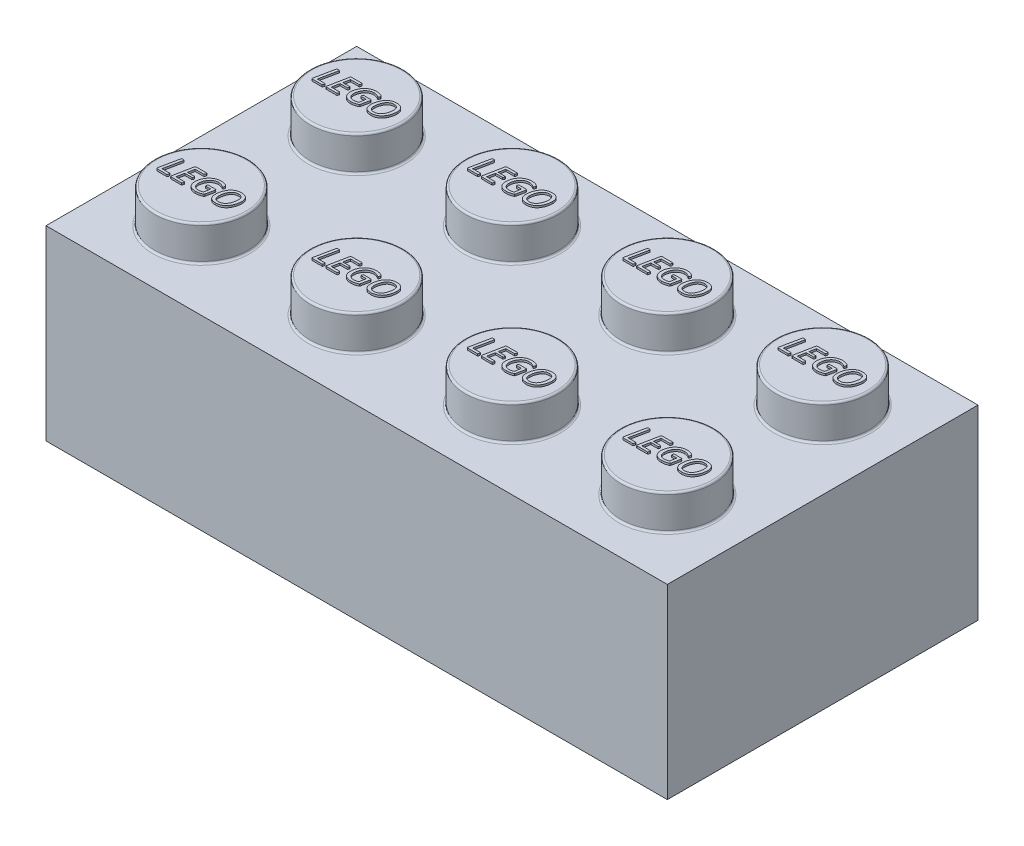
from build123d import *

# Parameters (mm, degrees)
SKETCH2_W              = 32
SKETCH2_H              = 16
BOSS_EXTRUDE1_DEPTH    = 9.6
SKETCH3_R              = 2.4
BOSS_EXTRUDE2_DEPTH    = 1.8
FILLET1_R              = 0.1
BOSS_EXTRUDE3_DEPTH    = 0.1
LPATTERN1_COUNT        = 4
LPATTERN1_PITCH        = 8
LPATTERN1_COUNT_DIR2   = 2
LPATTERN1_PITCH_DIR2   = 8
FILLET1_OF_LPATTERN1_R = 0.1


with BuildPart() as part:
    # Sketch2 → Boss-Extrude1 (new body)
    with BuildSketch(Plane(origin=(0, 0, 0), x_dir=(1, 0, 0), z_dir=(0, 1, 0))):
        Rectangle(SKETCH2_W, SKETCH2_H)
    extrude(amount=BOSS_EXTRUDE1_DEPTH)

    # Sketch3 → Boss-Extrude2 (add)
    with BuildSketch(Plane(origin=(0, 9.6, 0), x_dir=(1, 0, 0), z_dir=(0, 1, 0))):
        with Locations((-12, 4)):
            Circle(SKETCH3_R)
    boss_extrude2 = extrude(amount=BOSS_EXTRUDE2_DEPTH)

    # Fillet1
    fillet1_edges = [part.edges().sort_by_distance(p)[0] for p in [
        (-14.4, 11.4, -4),
        (-14.4, 9.6, -4),
    ]]
    fillet(fillet1_edges, radius=FILLET1_R)

    # Sketch4 → Boss-Extrude3 (add)
    # profile 1 of 4: a face of its own
    with BuildSketch(Plane(origin=(0, 11.4, 0), x_dir=(1, 0, 0), z_dir=(0, 1, 0))):
        with BuildLine():
            add(Edge.make_bspline(
                [(-13.239955728, 3.598746474), (-13.240011408, 3.596910982), (-13.240151135, 3.592304959), (-13.241297767, 3.584400609), (-13.242659472, 3.574712723), (-13.244716594, 3.564149378), (-13.246915271, 3.553119703), (-13.249510268, 3.542125181), (-13.252980365, 3.531408769), (-13.257613483, 3.521675555), (-13.26312257, 3.5129804), (-13.269421836, 3.505982115), (-13.276864093, 3.50088262), (-13.282468208, 3.500289539), (-13.285204112, 3.5)],
                knots=[0, 0, 0, 0, 0.568771865, 1.427287829, 2.47190915, 3.601509247, 4.761408276, 5.957823952, 7.101216275, 8.244900242, 9.290797826, 10.277630826, 11.159146825, 12, 12, 12, 12], degree=3))
            Line((-13.285204112, 3.5), (-13.775186617, 3.5))
            add(Edge.make_bspline(
                [(-13.775186617, 3.5), (-13.778357719, 3.500174379), (-13.784596761, 3.500517464), (-13.793734126, 3.502321168), (-13.80195586, 3.506508546), (-13.809190861, 3.512608473), (-13.814711711, 3.521089488), (-13.81832944, 3.5316915), (-13.818984108, 3.544636463), (-13.817009853, 3.553612034), (-13.815935162, 3.558497911)],
                knots=[0, 0, 0, 0, 0.895402587, 1.761676012, 2.602084678, 3.468358103, 4.400001905, 5.417696982, 6.594316012, 8, 8, 8, 8], degree=3))
            Line((-13.815935162, 3.558497911), (-13.607942589, 4.561962083))
            add(Edge.make_bspline(
                [(-13.607942589, 4.561962083), (-13.607462514, 4.563839367), (-13.606457615, 4.56776893), (-13.602674935, 4.573135592), (-13.59728199, 4.577892347), (-13.589623449, 4.581087248), (-13.580318415, 4.583797402), (-13.568672221, 4.585935711), (-13.554670361, 4.587847386), (-13.544453629, 4.587921302), (-13.538945052, 4.587961155)],
                knots=[0, 0, 0, 0, 0.584098656, 1.222644846, 1.958091128, 2.739123531, 3.71572132, 4.901592816, 6.329425505, 8, 8, 8, 8], degree=3))
            add(Edge.make_bspline(
                [(-13.538945052, 4.587961155), (-13.531936854, 4.587929435), (-13.519144014, 4.587871533), (-13.501817891, 4.585953529), (-13.487968053, 4.583905606), (-13.477612917, 4.581177958), (-13.469738137, 4.578197582), (-13.465282678, 4.573165167), (-13.463139133, 4.567469778), (-13.464011076, 4.563799848), (-13.464447712, 4.561962083)],
                knots=[0, 0, 0, 0, 1.908196571, 3.483242777, 4.748915692, 5.712962573, 6.41404198, 6.993040481, 7.495751958, 8, 8, 8, 8], degree=3))
            Line((-13.464447712, 4.561962083), (-13.656940839, 3.62799543))
            Line((-13.656940839, 3.62799543), (-13.260454996, 3.62799543))
            add(Edge.make_bspline(
                [(-13.260454996, 3.62799543), (-13.257139621, 3.627704925), (-13.250924, 3.627160291), (-13.243752866, 3.620198383), (-13.240579238, 3.610251547), (-13.240178157, 3.60285077), (-13.239955728, 3.598746474)],
                knots=[0, 0, 0, 0, 0.961104778, 1.801866576, 2.780966996, 4, 4, 4, 4], degree=3))
        make_face()
    # profile 2 of 4: a face of its own
    with BuildSketch(Plane(origin=(0, 11.4, 0), x_dir=(1, 0, 0), z_dir=(0, 1, 0))):
        with BuildLine():
            add(Edge.make_bspline(
                [(-12.295989432, 4.558462208), (-12.295963789, 4.556544763), (-12.295901287, 4.551871155), (-12.296564071, 4.544045073), (-12.297075253, 4.534572352), (-12.298927657, 4.524229535), (-12.301562376, 4.513294583), (-12.304074144, 4.502024868), (-12.307403207, 4.491000089), (-12.312179877, 4.481163058), (-12.317573408, 4.472385177), (-12.324240553, 4.465638331), (-12.33197867, 4.460883051), (-12.337677728, 4.460268667), (-12.340487843, 4.459965725)],
                knots=[0, 0, 0, 0, 0.591846085, 1.442574667, 2.423449858, 3.519120045, 4.680220593, 5.897286046, 7.085444994, 8.22495919, 9.267043524, 10.249604938, 11.136907775, 12, 12, 12, 12], degree=3))
            Line((-12.340487843, 4.459965725), (-12.773722374, 4.459965725))
            Line((-12.773722374, 4.459965725), (-12.839970009, 4.123977721))
            Line((-12.839970009, 4.123977721), (-12.475983005, 4.123977721))
            add(Edge.make_bspline(
                [(-12.475983005, 4.123977721), (-12.472957017, 4.123800329), (-12.467202858, 4.123463004), (-12.460245459, 4.11761815), (-12.456425708, 4.108782111), (-12.456142676, 4.102024093), (-12.455983719, 4.09822864)],
                knots=[0, 0, 0, 0, 0.958810056, 1.823254266, 2.777491275, 4, 4, 4, 4], degree=3))
            add(Edge.make_bspline(
                [(-12.455983719, 4.09822864), (-12.456037136, 4.096559247), (-12.456171285, 4.092366755), (-12.457377453, 4.085235116), (-12.458399675, 4.076439805), (-12.460298699, 4.066895451), (-12.461983891, 4.056916791), (-12.465127726, 4.047387541), (-12.468459741, 4.038198948), (-12.47298859, 4.030152346), (-12.477944044, 4.022768802), (-12.484209384, 4.017170164), (-12.491288924, 4.012573179), (-12.496747166, 4.012179156), (-12.499482166, 4.01198172)],
                knots=[0, 0, 0, 0, 0.57613514, 1.446898036, 2.492589559, 3.632582086, 4.806205701, 5.980181914, 7.091495414, 8.172987284, 9.162970952, 10.140332126, 11.068163061, 12, 12, 12, 12], degree=3))
            Line((-12.499482166, 4.01198172), (-12.862219215, 4.01198172))
            Line((-12.862219215, 4.01198172), (-12.938466492, 3.62799543))
            Line((-12.938466492, 3.62799543), (-12.507231889, 3.62799543))
            add(Edge.make_bspline(
                [(-12.507231889, 3.62799543), (-12.504625311, 3.627661682), (-12.499200978, 3.626967146), (-12.492654447, 3.620585431), (-12.488175198, 3.610830914), (-12.488052676, 3.602985239), (-12.487982577, 3.598496483)],
                knots=[0, 0, 0, 0, 0.784088755, 1.631702308, 2.64502263, 4, 4, 4, 4], degree=3))
            add(Edge.make_bspline(
                [(-12.487982577, 3.598496483), (-12.488042517, 3.596328385), (-12.488183381, 3.591233155), (-12.489059185, 3.582829673), (-12.489841869, 3.573030495), (-12.491698357, 3.562623665), (-12.493986245, 3.55179627), (-12.496556194, 3.540796628), (-12.500021023, 3.530042212), (-12.504304463, 3.520179303), (-12.509841791, 3.511654712), (-12.516457613, 3.505229534), (-12.523994076, 3.500648704), (-12.529505906, 3.500214616), (-12.532230997, 3.5)],
                knots=[0, 0, 0, 0, 0.670135299, 1.574879358, 2.610233293, 3.706880817, 4.838360642, 6.031477602, 7.196179589, 8.325899269, 9.347385511, 10.31278335, 11.165827431, 12, 12, 12, 12], degree=3))
            Line((-12.532230997, 3.5), (-13.055462315, 3.5))
            add(Edge.make_bspline(
                [(-13.055462315, 3.5), (-13.058557473, 3.500148994), (-13.064746665, 3.500446928), (-13.073779834, 3.502702159), (-13.08217952, 3.506665529), (-13.089482844, 3.512805036), (-13.094747081, 3.52148481), (-13.098358131, 3.532191288), (-13.099019889, 3.545305047), (-13.097032808, 3.554362047), (-13.095960869, 3.559247885)],
                knots=[0, 0, 0, 0, 0.86808732, 1.735859602, 2.593489566, 3.455888593, 4.370600893, 5.405902384, 6.600602917, 8, 8, 8, 8], degree=3))
            Line((-13.095960869, 3.559247885), (-12.903967724, 4.529463243))
            add(Edge.make_bspline(
                [(-12.903967724, 4.529463243), (-12.902796522, 4.534511355), (-12.90057012, 4.544107594), (-12.894899253, 4.557023297), (-12.887186708, 4.567476899), (-12.874951699, 4.577404576), (-12.858229868, 4.585764587), (-12.843977396, 4.587254681), (-12.837220107, 4.587961155)],
                knots=[0, 0, 0, 0, 0.962086969, 1.828885145, 2.603553515, 3.3514195, 4.744272368, 6, 6, 6, 6], degree=3))
            Line((-12.837220107, 4.587961155), (-12.315488736, 4.587961155))
            add(Edge.make_bspline(
                [(-12.315488736, 4.587961155), (-12.312540978, 4.587688196), (-12.306765321, 4.587153377), (-12.29971648, 4.580654144), (-12.296555105, 4.570458965), (-12.296194588, 4.56281315), (-12.295989432, 4.558462208)],
                knots=[0, 0, 0, 0, 0.868834108, 1.702340839, 2.692489738, 4, 4, 4, 4], degree=3))
        make_face()
    # profile 3 of 4: a face of its own
    with BuildSketch(Plane(origin=(0, 11.4, 0), x_dir=(1, 0, 0), z_dir=(0, 1, 0))):
        with BuildLine():
            add(Edge.make_bspline(
                [(-11.240027135, 4.475965153), (-11.24270789, 4.471390952), (-11.247256786, 4.463629122), (-11.25122738, 4.452250571), (-11.252354096, 4.442565808), (-11.254619017, 4.43355113), (-11.256694045, 4.423963446), (-11.259670316, 4.414291727), (-11.263009519, 4.404957794), (-11.266909827, 4.396663652), (-11.271458767, 4.389911641), (-11.276062314, 4.384447144), (-11.281474499, 4.380878054), (-11.285400986, 4.380262459), (-11.287275448, 4.379968581)],
                knots=[0, 0, 0, 0, 1.708538531, 2.899169663, 3.854177075, 4.845964626, 5.896193902, 7.019304276, 8.108412714, 9.094715684, 9.967412485, 10.729029053, 11.393252368, 12, 12, 12, 12], degree=3))
            add(Edge.make_bspline(
                [(-11.287275448, 4.379968581), (-11.289628245, 4.380211112), (-11.294795807, 4.380743796), (-11.302845298, 4.383786788), (-11.311923182, 4.388382247), (-11.322074885, 4.394811265), (-11.333750728, 4.402246866), (-11.34692982, 4.41081637), (-11.362583288, 4.418608017), (-11.379442477, 4.427953319), (-11.398439274, 4.436752232), (-11.419216996, 4.445759604), (-11.442267819, 4.453397869), (-11.467004172, 4.461482658), (-11.494138614, 4.46795918), (-11.523791536, 4.472711215), (-11.556050747, 4.475366137), (-11.57842698, 4.475760783), (-11.590014638, 4.475965153)],
                knots=[0, 0, 0, 0, 0.35075506, 0.77038039, 1.269513591, 1.865022966, 2.55648655, 3.330734152, 4.201726841, 5.155883762, 6.19875353, 7.315813409, 8.523755987, 9.810243116, 11.187822172, 12.669995774, 14.27553851, 16, 16, 16, 16], degree=3))
            add(Edge.make_bspline(
                [(-11.590014638, 4.475965153), (-11.602107946, 4.475645303), (-11.625860721, 4.475017078), (-11.661005082, 4.470982551), (-11.694890191, 4.46404468), (-11.727497623, 4.454143479), (-11.758909467, 4.442102826), (-11.78907102, 4.427890143), (-11.818017374, 4.411566949), (-11.845505271, 4.393075142), (-11.871416211, 4.372503555), (-11.896145415, 4.350395866), (-11.919366539, 4.326413911), (-11.940983549, 4.300638478), (-11.961341456, 4.273701791), (-11.979765844, 4.245228354), (-11.997144639, 4.215841374), (-12.012508146, 4.185118637), (-12.026299901, 4.153585075), (-12.038357616, 4.121214605), (-12.048579059, 4.087982405), (-12.057000015, 4.054084597), (-12.063869557, 4.019738439), (-12.068552898, 3.98508802), (-12.071368814, 3.950114159), (-12.071787085, 3.926739902), (-12.071997429, 3.914985183)],
                knots=[0, 0, 0, 0, 1.060592552, 2.083136893, 3.09789515, 4.089790102, 5.068349321, 6.045843656, 7.011242545, 7.980120559, 8.948005813, 9.910579057, 10.887390164, 11.872721123, 12.859325068, 13.84647021, 14.845447534, 15.852094253, 16.856829111, 17.862732761, 18.879856731, 19.904357896, 20.92483699, 21.95011984, 22.969132426, 24, 24, 24, 24], degree=3))
            add(Edge.make_bspline(
                [(-12.071997429, 3.914985183), (-12.071796288, 3.903056548), (-12.071405441, 3.879877506), (-12.067262985, 3.846178389), (-12.060793957, 3.814567195), (-12.052034411, 3.784940214), (-12.039937823, 3.757868147), (-12.026457516, 3.73260447), (-12.009864678, 3.710005541), (-11.99147477, 3.689329933), (-11.970510723, 3.671405664), (-11.947835201, 3.655408395), (-11.923004172, 3.641914685), (-11.896156714, 3.630951555), (-11.867514529, 3.622419767), (-11.837109524, 3.616568092), (-11.805108015, 3.61265981), (-11.783186408, 3.612220178), (-11.77200814, 3.611996001)],
                knots=[0, 0, 0, 0, 1.181970393, 2.296737304, 3.359485772, 4.378575854, 5.351525673, 6.294270406, 7.211332436, 8.1237322, 9.031370573, 9.938858576, 10.87039016, 11.826074427, 12.808759046, 13.827748687, 14.892325471, 16, 16, 16, 16], degree=3))
            add(Edge.make_bspline(
                [(-11.77200814, 3.611996001), (-11.753058225, 3.612587812), (-11.714194224, 3.613801544), (-11.665679391, 3.621834285), (-11.626701644, 3.630876714), (-11.598042336, 3.639405935), (-11.570427747, 3.649572598), (-11.552794178, 3.657865869), (-11.544016281, 3.661994216)],
                knots=[0, 0, 0, 0, 1.449162186, 2.972057555, 3.751408587, 4.509801149, 5.258186919, 6, 6, 6, 6], degree=3))
            Line((-11.544016281, 3.661994216), (-11.492768111, 3.979982862))
            Line((-11.492768111, 3.979982862), (-11.746759042, 3.979982862))
            add(Edge.make_bspline(
                [(-11.746759042, 3.979982862), (-11.749845585, 3.980284134), (-11.75575999, 3.980861429), (-11.763308338, 3.986468101), (-11.767275311, 3.995596855), (-11.767747238, 4.002444283), (-11.768008283, 4.006231925)],
                knots=[0, 0, 0, 0, 0.962911393, 1.845121753, 2.808033146, 4, 4, 4, 4], degree=3))
            add(Edge.make_bspline(
                [(-11.768008283, 4.006231925), (-11.767964717, 4.008401418), (-11.767867152, 4.013259846), (-11.766723726, 4.021171873), (-11.765226834, 4.030068934), (-11.763726604, 4.039610405), (-11.760765132, 4.049039753), (-11.75762942, 4.058532662), (-11.753823019, 4.067600539), (-11.749041521, 4.075671377), (-11.74367387, 4.082481248), (-11.737460043, 4.087588995), (-11.730757273, 4.091519519), (-11.725727008, 4.091827709), (-11.723259881, 4.091978863)],
                knots=[0, 0, 0, 0, 0.748041407, 1.675187075, 2.752816561, 3.863681367, 5.001016553, 6.155661575, 7.314593661, 8.384525695, 9.385819904, 10.283985081, 11.158369017, 12, 12, 12, 12], degree=3))
            Line((-11.723259881, 4.091978863), (-11.370272484, 4.091978863))
            add(Edge.make_bspline(
                [(-11.370272484, 4.091978863), (-11.36649828, 4.09190931), (-11.359413472, 4.091778746), (-11.349734672, 4.088889628), (-11.341515546, 4.084601797), (-11.335104807, 4.078188755), (-11.330754883, 4.069819826), (-11.328609138, 4.05968686), (-11.328400075, 4.047805977), (-11.329944227, 4.039463361), (-11.330773895, 4.034980899)],
                knots=[0, 0, 0, 0, 1.082729752, 2.032463274, 2.881252001, 3.730040728, 4.599956008, 5.560850828, 6.689452614, 8, 8, 8, 8], degree=3))
            Line((-11.330773895, 4.034980899), (-11.416020851, 3.617995787))
            add(Edge.make_bspline(
                [(-11.416020851, 3.617995787), (-11.417187267, 3.613107646), (-11.419308357, 3.604218719), (-11.424588637, 3.592552942), (-11.430486762, 3.582881068), (-11.43519253, 3.577439048), (-11.437520083, 3.574747331)],
                knots=[0, 0, 0, 0, 1.230304509, 2.237269107, 3.128122902, 4, 4, 4, 4], degree=3))
            add(Edge.make_bspline(
                [(-11.437520083, 3.574747331), (-11.4392407, 3.573290923), (-11.443452288, 3.569726045), (-11.451782051, 3.564716761), (-11.462958271, 3.558640611), (-11.476985732, 3.55183274), (-11.493404304, 3.544359559), (-11.512236096, 3.537247658), (-11.53276326, 3.529352251), (-11.564034804, 3.519229618), (-11.607133375, 3.507069984), (-11.663000392, 3.494561289), (-11.723407434, 3.485705402), (-11.765059804, 3.484575569), (-11.786257632, 3.484000571)],
                knots=[0, 0, 0, 0, 0.222363916, 0.544284391, 0.956773704, 1.479430973, 2.08359794, 2.737719287, 3.466904263, 4.255488112, 5.982879016, 7.887848517, 9.907233696, 12, 12, 12, 12], degree=3))
            add(Edge.make_bspline(
                [(-11.786257632, 3.484000571), (-11.803851979, 3.48432895), (-11.838123011, 3.484968581), (-11.887907845, 3.490133005), (-11.93443276, 3.499258968), (-11.977796369, 3.511283561), (-12.017764849, 3.527056893), (-12.054266393, 3.546266937), (-12.087751532, 3.56817224), (-12.117756037, 3.59359155), (-12.144034303, 3.622327771), (-12.167198246, 3.653741707), (-12.186971732, 3.68797819), (-12.203691755, 3.724901831), (-12.216193826, 3.764745775), (-12.22554296, 3.807047485), (-12.231081771, 3.851839809), (-12.23168416, 3.882554196), (-12.231991717, 3.898235781)],
                knots=[0, 0, 0, 0, 1.221256866, 2.378817054, 3.469072572, 4.509204801, 5.49855179, 6.44557626, 7.368114754, 8.271019988, 9.167583877, 10.065415892, 10.975243719, 11.907380971, 12.873315437, 13.868446307, 14.911710625, 16, 16, 16, 16], degree=3))
            add(Edge.make_bspline(
                [(-12.231991717, 3.898235781), (-12.231783005, 3.91324575), (-12.231367148, 3.943153007), (-12.227041602, 3.987691196), (-12.220983126, 4.031888502), (-12.21191105, 4.075527842), (-12.200423006, 4.118496073), (-12.186631783, 4.160434674), (-12.170932446, 4.201427315), (-12.152632562, 4.241122194), (-12.132206121, 4.279531329), (-12.109586067, 4.316575322), (-12.084567129, 4.352025314), (-12.057321421, 4.386050998), (-12.027984184, 4.41826616), (-11.996322783, 4.448093171), (-11.962736294, 4.475639502), (-11.927186079, 4.501057489), (-11.88938706, 4.523666807), (-11.849880051, 4.544063257), (-11.808392211, 4.561424294), (-11.765370516, 4.576869982), (-11.720382376, 4.589249177), (-11.673335061, 4.597528169), (-11.624642819, 4.603005827), (-11.591529831, 4.603639675), (-11.574765183, 4.603960583)],
                knots=[0, 0, 0, 0, 1.005094864, 2.002644506, 2.994886204, 3.992139098, 4.985933835, 5.972633824, 6.948044167, 7.924603705, 8.898447688, 9.860527448, 10.829946448, 11.802782153, 12.778623603, 13.74599967, 14.713681646, 15.68632518, 16.67038509, 17.661432906, 18.661867336, 19.680509808, 20.72177877, 21.782670317, 22.877396675, 24, 24, 24, 24], degree=3))
            add(Edge.make_bspline(
                [(-11.574765183, 4.603960583), (-11.555148552, 4.603567557), (-11.517085342, 4.602804948), (-11.46241899, 4.594483663), (-11.412600475, 4.583711056), (-11.368156625, 4.570732665), (-11.329684697, 4.556382789), (-11.302169484, 4.542382799), (-11.284041852, 4.531104417), (-11.27288774, 4.524557751), (-11.264354466, 4.518518357), (-11.256409163, 4.512137798), (-11.248841432, 4.5053819), (-11.243224606, 4.496314962), (-11.240214425, 4.486495575), (-11.240092769, 4.479655451), (-11.240027135, 4.475965153)],
                knots=[0, 0, 0, 0, 2.178054518, 4.226196863, 6.131517518, 7.83979396, 9.366897682, 10.687989248, 11.261283311, 11.73931495, 12.124688567, 12.421151204, 12.872994386, 13.243044458, 13.591616828, 14, 14, 14, 14], degree=3))
        make_face()
    # profile 4 of 4: a face of its own
    with BuildSketch(Plane(origin=(0, 11.4, 0), x_dir=(1, 0, 0), z_dir=(0, 1, 0))):
        with BuildLine():
            add(Edge.make_bspline(
                [(-10.136066551, 4.222974186), (-10.136220366, 4.21188784), (-10.136537538, 4.189027375), (-10.138924409, 4.153754489), (-10.142688677, 4.116571729), (-10.147864575, 4.077774746), (-10.15483019, 4.037887147), (-10.163735275, 3.997377671), (-10.175197445, 3.956692295), (-10.187975611, 3.915694745), (-10.203283717, 3.874986531), (-10.220745298, 3.834615368), (-10.240862258, 3.794894784), (-10.262938111, 3.755818969), (-10.28720375, 3.717850958), (-10.31497401, 3.682432368), (-10.344942718, 3.648671987), (-10.377967558, 3.61746687), (-10.413947237, 3.588654304), (-10.45325615, 3.562974747), (-10.495799614, 3.540197849), (-10.541287433, 3.520075853), (-10.590145352, 3.503637848), (-10.642629245, 3.492327294), (-10.698429455, 3.48513864), (-10.736855382, 3.484386143), (-10.756544397, 3.484000571)],
                knots=[0, 0, 0, 0, 0.738858828, 1.523554751, 2.35527118, 3.229497206, 4.131628379, 5.053310874, 5.992464906, 6.947996886, 7.91460182, 8.889642496, 9.878192886, 10.880517165, 11.880299328, 12.877904002, 13.876929987, 14.886597849, 15.902296723, 16.945162001, 18.01119579, 19.115350212, 20.256946973, 21.440074658, 22.688322868, 24, 24, 24, 24], degree=3))
            add(Edge.make_bspline(
                [(-10.756544397, 3.484000571), (-10.772139449, 3.484263913), (-10.80231534, 3.484773471), (-10.846186598, 3.489399779), (-10.887113389, 3.496702721), (-10.925129126, 3.507207451), (-10.960111609, 3.52067072), (-10.992015281, 3.537255906), (-11.021064672, 3.556558598), (-11.047039198, 3.578967059), (-11.069781863, 3.604378199), (-11.089815928, 3.632380209), (-11.106535571, 3.663335485), (-11.120279894, 3.697042079), (-11.131104619, 3.733452967), (-11.138318051, 3.772684439), (-11.143331345, 3.814526572), (-11.143793034, 3.843388428), (-11.144030562, 3.858237209)],
                knots=[0, 0, 0, 0, 1.214107583, 2.349256512, 3.43114695, 4.448216178, 5.415892755, 6.344666895, 7.242761054, 8.126105007, 9.008304114, 9.892410474, 10.801317573, 11.741268591, 12.722707314, 13.753573727, 14.844263791, 16, 16, 16, 16], degree=3))
            add(Edge.make_bspline(
                [(-11.144030562, 3.858237209), (-11.143906172, 3.870491599), (-11.143652066, 3.89552511), (-11.140860357, 3.933694113), (-11.137244004, 3.973320543), (-11.131834313, 4.014053444), (-11.12420116, 4.055462879), (-11.115225913, 4.097110355), (-11.103434513, 4.138559621), (-11.090141313, 4.179949075), (-11.074373805, 4.220928308), (-11.056380946, 4.261125758), (-11.036225569, 4.300561525), (-11.014222838, 4.339253937), (-10.989473331, 4.37645728), (-10.962349788, 4.411883552), (-10.932021973, 4.444597131), (-10.899672737, 4.475646413), (-10.863949164, 4.503532049), (-10.825756658, 4.529103749), (-10.784112475, 4.550595174), (-10.740063296, 4.56994602), (-10.692525496, 4.585225219), (-10.641626228, 4.596145002), (-10.587387272, 4.602685886), (-10.550153484, 4.603528381), (-10.531052449, 4.603960583)],
                knots=[0, 0, 0, 0, 0.815642365, 1.666210478, 2.54664585, 3.464574111, 4.400365285, 5.349251936, 6.299483549, 7.267856163, 8.242453364, 9.220832363, 10.198330251, 11.189847475, 12.182233362, 13.170891032, 14.156415467, 15.149219903, 16.152492646, 17.16950511, 18.20427599, 19.26776378, 20.369484414, 21.521762376, 22.728657262, 24, 24, 24, 24], degree=3))
            add(Edge.make_bspline(
                [(-10.531052449, 4.603960583), (-10.515205563, 4.603720053), (-10.48451864, 4.603254275), (-10.439985883, 4.598317108), (-10.398472076, 4.590775198), (-10.359904519, 4.579942496), (-10.324178715, 4.566331694), (-10.291629092, 4.549251969), (-10.262014225, 4.529409569), (-10.235660184, 4.506486925), (-10.212142827, 4.480809836), (-10.191897925, 4.452095475), (-10.174443099, 4.4206488), (-10.160621115, 4.386224974), (-10.14956998, 4.349238451), (-10.141623303, 4.309584707), (-10.136810621, 4.267175401), (-10.136319268, 4.237986761), (-10.136066551, 4.222974186)],
                knots=[0, 0, 0, 0, 1.212485212, 2.347933949, 3.425039663, 4.438731364, 5.41001802, 6.345785403, 7.246236355, 8.132478834, 9.012895177, 9.904880133, 10.81557402, 11.759587163, 12.738301069, 13.766537154, 14.85126446, 16, 16, 16, 16], degree=3))
        make_face()
        with BuildLine():
            add(Edge.make_bspline(
                [(-10.296060839, 4.210724624), (-10.296147349, 4.220316261), (-10.296316244, 4.239042171), (-10.299319794, 4.266490998), (-10.303428392, 4.29274086), (-10.309325531, 4.317805741), (-10.317383443, 4.341276996), (-10.327044439, 4.363422881), (-10.339366855, 4.383505765), (-10.353468084, 4.402075735), (-10.369928718, 4.418811665), (-10.388923156, 4.433530248), (-10.410532065, 4.446071607), (-10.434388674, 4.456812579), (-10.460693947, 4.465719152), (-10.489773338, 4.471452472), (-10.521280895, 4.475338353), (-10.543205643, 4.475751402), (-10.55455161, 4.475965153)],
                knots=[0, 0, 0, 0, 1.084001636, 2.116314131, 3.118601967, 4.08764953, 5.023319799, 5.921712705, 6.813757868, 7.680715459, 8.553593008, 9.460200919, 10.389443661, 11.372048813, 12.414972226, 13.521951909, 14.717620436, 16, 16, 16, 16], degree=3))
            add(Edge.make_bspline(
                [(-10.55455161, 4.475965153), (-10.568571978, 4.475594793), (-10.595914325, 4.474872521), (-10.635629433, 4.468860851), (-10.672611533, 4.458586548), (-10.706881134, 4.444383697), (-10.738627533, 4.427127442), (-10.767999191, 4.407046809), (-10.795754747, 4.385262349), (-10.820638396, 4.360304054), (-10.843397166, 4.333382084), (-10.86441584, 4.304989361), (-10.883339368, 4.274747823), (-10.905195941, 4.232451483), (-10.928282507, 4.177926773), (-10.950245206, 4.111753303), (-10.96605827, 4.046196023), (-10.975132358, 3.992747732), (-10.979912138, 3.952035807), (-10.982045299, 3.923837086), (-10.983723816, 3.897755581), (-10.983935329, 3.880988791), (-10.984036275, 3.872986683)],
                knots=[0, 0, 0, 0, 1.021874751, 1.992847393, 2.920064192, 3.813667739, 4.691811797, 5.549540999, 6.405417606, 7.260366409, 8.113781051, 8.97413151, 9.833902544, 10.711689218, 12.442870184, 14.145151668, 15.789693117, 17.354879628, 18.094944167, 18.777616403, 19.416605934, 20, 20, 20, 20], degree=3))
            add(Edge.make_bspline(
                [(-10.984036275, 3.872986683), (-10.983922311, 3.863314306), (-10.983699869, 3.844435103), (-10.981097093, 3.81688638), (-10.977097398, 3.790757711), (-10.971782085, 3.766015815), (-10.964345103, 3.74281099), (-10.95442428, 3.721443335), (-10.942758067, 3.701491128), (-10.928570353, 3.683505706), (-10.91263315, 3.66689537), (-10.893716732, 3.653110417), (-10.873295158, 3.640324168), (-10.850180096, 3.630174157), (-10.824789352, 3.621759926), (-10.79656972, 3.616237932), (-10.765801213, 3.612694659), (-10.744388942, 3.612234441), (-10.733295227, 3.611996001)],
                knots=[0, 0, 0, 0, 1.115819048, 2.177931517, 3.189752381, 4.164950242, 5.095460777, 5.994741592, 6.878673775, 7.755780125, 8.632939184, 9.525304337, 10.448832703, 11.408595387, 12.430328723, 13.529785657, 14.720179943, 16, 16, 16, 16], degree=3))
            add(Edge.make_bspline(
                [(-10.733295227, 3.611996001), (-10.719108742, 3.612378465), (-10.691530439, 3.61312197), (-10.651531072, 3.618921671), (-10.614137508, 3.628580142), (-10.579567468, 3.642645621), (-10.547168359, 3.659269597), (-10.51748346, 3.679123102), (-10.489342555, 3.700405292), (-10.464249088, 3.724986733), (-10.440857771, 3.751244422), (-10.419773949, 3.779439427), (-10.40052654, 3.809245103), (-10.377869178, 3.851032706), (-10.353853132, 3.905021444), (-10.331108747, 3.970836406), (-10.314366755, 4.035990823), (-10.305376206, 4.089459214), (-10.300838983, 4.130369941), (-10.297903112, 4.158763491), (-10.296396139, 4.185375282), (-10.296169979, 4.202473428), (-10.296060839, 4.210724624)],
                knots=[0, 0, 0, 0, 1.031404921, 2.005034886, 2.932590011, 3.832898318, 4.713845109, 5.576145971, 6.42712792, 7.275797677, 8.125851184, 8.982789917, 9.833404929, 10.704014048, 12.437431345, 14.124025693, 15.762941425, 17.324180739, 18.062378933, 18.756471173, 19.399899859, 20, 20, 20, 20], degree=3))
        make_face(mode=Mode.SUBTRACT)
    boss_extrude3 = extrude(amount=BOSS_EXTRUDE3_DEPTH)

    # LPattern1: Boss-Extrude2, Boss-Extrude3 4 × 2
    with Locations(*[(i * LPATTERN1_PITCH, 0, j * LPATTERN1_PITCH_DIR2) for i in range(LPATTERN1_COUNT) for j in range(LPATTERN1_COUNT_DIR2) if (i, j) != (0, 0)]):
        add(boss_extrude2)
        add(boss_extrude3)

    # Fillet1 of LPattern1
    fillet1_of_lpattern1_edges = [part.edges().sort_by_distance(p)[0] for p in [
        (-14.4, 11.4, 4),
        (-14.4, 9.6, 4),
        (-6.4, 11.4, -4),
        (-6.4, 9.6, -4),
        (-6.4, 11.4, 4),
        (-6.4, 9.6, 4),
        (1.6, 11.4, -4),
        (1.6, 9.6, -4),
        (1.6, 11.4, 4),
        (1.6, 9.6, 4),
        (9.6, 11.4, -4),
        (9.6, 9.6, -4),
        (9.6, 11.4, 4),
        (9.6, 9.6, 4),
    ]]
    fillet(fillet1_of_lpattern1_edges, radius=FILLET1_OF_LPATTERN1_R)


solid = part.part
